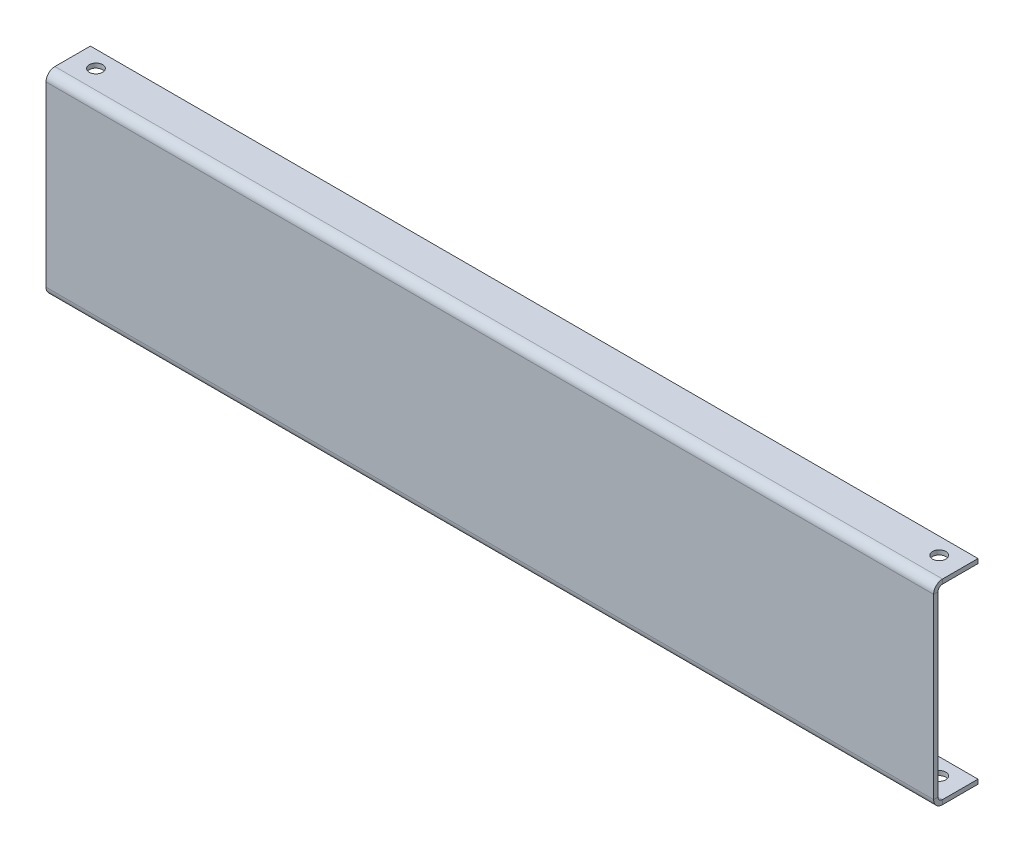
from build123d import *

# Parameters (mm, degrees)
SM_BASE_FLANGE_2_DEPTH = 400
SKETCH_15_R            = 3
CUT_EXTRUDE_2_DEPTH    = 411.075127263


# Sheet-metal steps are written as plain solids
with BuildPart() as part:
    # Эскиз9 → Базовая кромка2 (new body)
    with BuildSketch(Plane(origin=(0, 0, 0), x_dir=(0, 0, -1), z_dir=(1, 0, 0))):
        with BuildLine():
            Line((0, 0), (-16, 0))
            ThreePointArc((-16, 0), (-18.828427125, -1.171572875), (-20, -4))
            Line((-20, -4), (-20, -84.1))
            ThreePointArc((-20, -84.1), (-18.828427125, -86.928427125), (-16, -88.1))
            Line((-16, -88.1), (0, -88.1))
            Line((0, -88.1), (0, -86.1))
            Line((0, -86.1), (-16, -86.1))
            ThreePointArc((-16, -86.1), (-17.414213562, -85.514213562), (-18, -84.1))
            Line((-18, -84.1), (-18, -4))
            ThreePointArc((-18, -4), (-17.414213562, -2.585786438), (-16, -2))
            Line((-16, -2), (0, -2))
            Line((0, -2), (0, 0))
        make_face()
    extrude(amount=SM_BASE_FLANGE_2_DEPTH)

    # Эскиз15 → Вырез-Вытянуть2 (cut, through all)
    with BuildSketch(Plane(origin=(0, 0, 0), x_dir=(1, 0, 0), z_dir=(0, 1, 0))):
        with Locations(Location((390, -7.5, 0), (0, 0, 270))):
            Circle(SKETCH_15_R)
        with Locations(Location((10, -7.5, 0), (0, 0, 270))):
            Circle(SKETCH_15_R)
    extrude(amount=-CUT_EXTRUDE_2_DEPTH, mode=Mode.SUBTRACT)


solid = part.part
